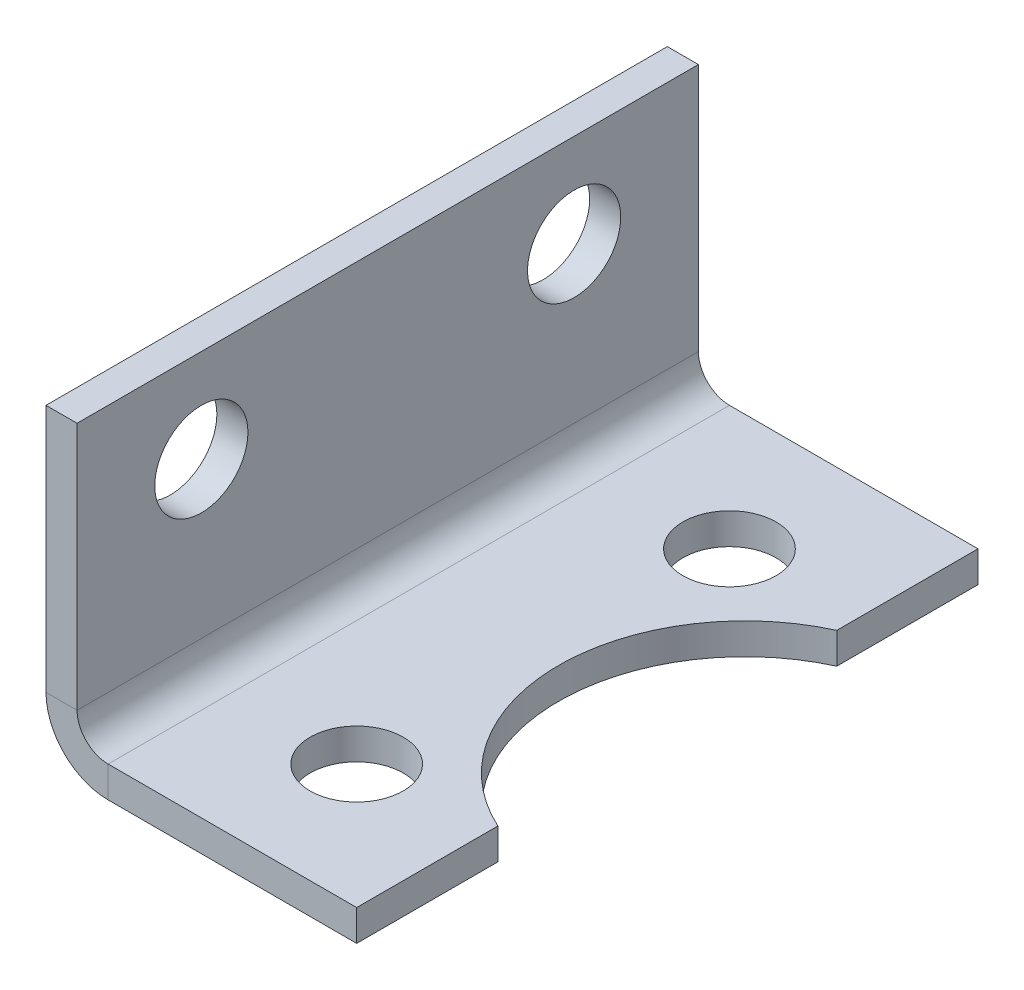
from build123d import *

# Parameters (mm, degrees)
BASE_FLANGE2_DEPTH = 40
SKETCH11_R         = 3
CUT_EXTRUDE2_DEPTH = 10
SKETCH12_R         = 12
SKETCH12_R_2       = 3
CUT_EXTRUDE3_DEPTH = 10


# Sheet-metal steps are written as plain solids
with BuildPart() as part:
    # Sketch1 → Base-Flange2 (new body)
    with BuildSketch(Plane.XY):
        with BuildLine():
            Line((0, 18), (0, 2))
            ThreePointArc((0, 2), (0.585786438, 0.585786438), (2, 0))
            Line((2, 0), (18, 0))
            Line((18, 0), (18, -2))
            Line((18, -2), (2, -2))
            ThreePointArc((2, -2), (-0.828427125, -0.828427125), (-2, 2))
            Line((-2, 2), (-2, 18))
            Line((-2, 18), (0, 18))
        make_face()
    extrude(amount=BASE_FLANGE2_DEPTH)

    # Sketch11 → Cut-Extrude2 (cut)
    with BuildSketch(Plane(origin=(0, 0, 0), x_dir=(0, 0, -1), z_dir=(1, 0, 0))):
        with Locations((-32, 12)):
            Circle(SKETCH11_R)
        with Locations((-8, 12)):
            Circle(SKETCH11_R)
    extrude(amount=-CUT_EXTRUDE2_DEPTH, mode=Mode.SUBTRACT)

    # Sketch12 → Cut-Extrude3 (cut)
    with BuildSketch(Plane(origin=(0, 0, 0), x_dir=(1, 0, 0), z_dir=(0, 1, 0))):
        with Locations((23, -20)):
            Circle(SKETCH12_R)
        with Locations(Location((10, -8, 0), (0, 0, 270))):
            Circle(SKETCH12_R_2)
        with Locations(Location((10, -32, 0), (0, 0, 270))):
            Circle(SKETCH12_R_2)
    extrude(amount=-CUT_EXTRUDE3_DEPTH, mode=Mode.SUBTRACT)


solid = part.part
